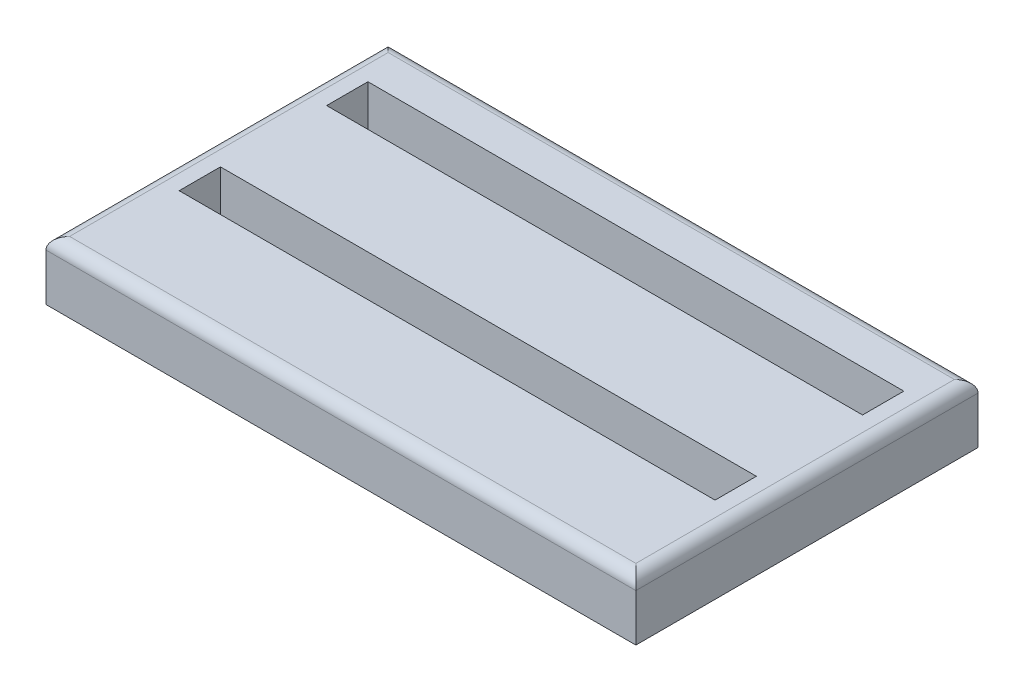
from build123d import *

# Parameters (mm, degrees)
SKETCH2_W           = 127
SKETCH2_H           = 73.66
BOSS_EXTRUDE1_DEPTH = 12.7
FILLET1_R           = 2.54
SKETCH3_W           = 115.38555028
SKETCH3_H           = 8.89
CUT_EXTRUDE1_DEPTH  = 12.7


with BuildPart() as part:
    # Sketch2 → Boss-Extrude1 (new body)
    with BuildSketch(Plane(origin=(0, 0, 0), x_dir=(1, 0, 0), z_dir=(0, 1, 0))):
        with Locations((0, -6.35)):
            Rectangle(SKETCH2_W, SKETCH2_H)
    extrude(amount=BOSS_EXTRUDE1_DEPTH)

    # Fillet1
    fillet1_edges = [part.edges().sort_by_distance(p)[0] for p in [
        (63.5, 12.7, 6.35),
        (-63.5, 12.7, 6.35),
        (0, 12.7, 43.18),
        (0, 12.7, -30.48),
    ]]
    fillet(fillet1_edges, radius=FILLET1_R)

    # Sketch3 → Cut-Extrude1 (cut)
    with BuildSketch(Plane(origin=(0, 12.7, 0), x_dir=(1, 0, 0), z_dir=(0, 1, 0))):
        with Locations((-2.54e-06, 15.875)):
            Rectangle(SKETCH3_W, SKETCH3_H)
        with Locations((-2.54e-06, -15.875)):
            Rectangle(SKETCH3_W, SKETCH3_H)
    extrude(amount=-CUT_EXTRUDE1_DEPTH, mode=Mode.SUBTRACT)


solid = part.part
